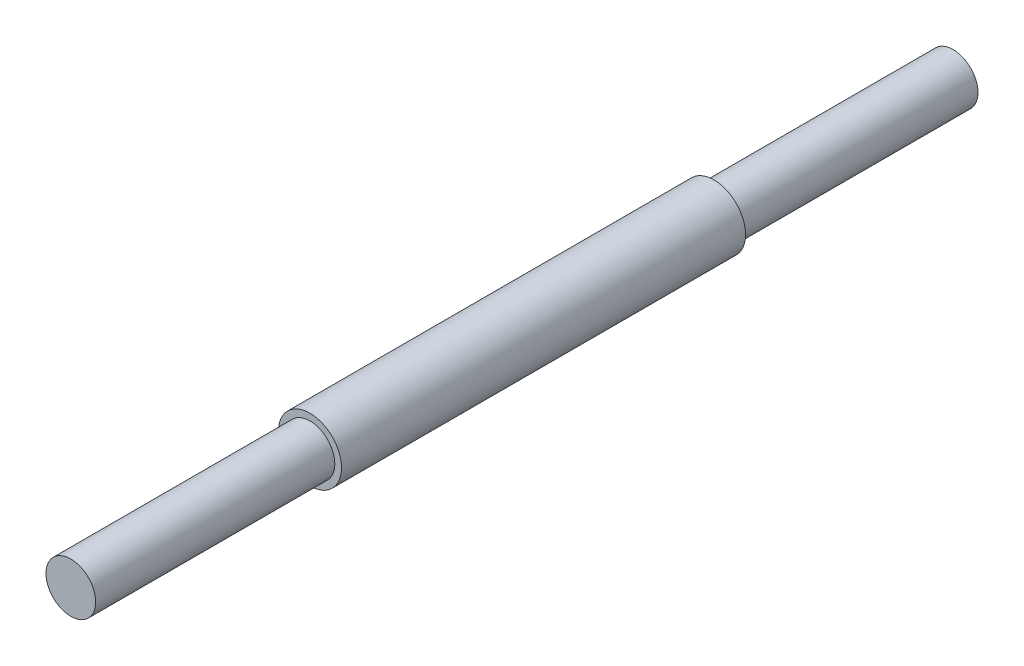
from build123d import *

# Parameters (mm, degrees)
BOSS_EXTRUDE1_DEPTH      = 44.3738
BOSS_EXTRUDE1_DEPTH_BACK = 44.3738
SKETCH2_R                = 2.5
BOSS_EXTRUDE2_DEPTH      = 20.32
BOSS_EXTRUDE2_DEPTH_BACK = 20.32
SKETCH3_R                = 3.175


with BuildPart() as part:
    # Sketch2 → Boss-Extrude1 (new, two sides: drawn at the far end of the back side and taken through both)
    with BuildSketch(Plane.XY.offset(-BOSS_EXTRUDE1_DEPTH_BACK)):
        Circle(SKETCH2_R)
    extrude(amount=BOSS_EXTRUDE1_DEPTH + BOSS_EXTRUDE1_DEPTH_BACK)

    # Sketch3 → Boss-Extrude2 (add, two sides: drawn at the far end of the back side and taken through both)
    with BuildSketch(Plane.XY.offset(-BOSS_EXTRUDE2_DEPTH_BACK)):
        Circle(SKETCH3_R)
    extrude(amount=BOSS_EXTRUDE2_DEPTH + BOSS_EXTRUDE2_DEPTH_BACK)


solid = part.part
